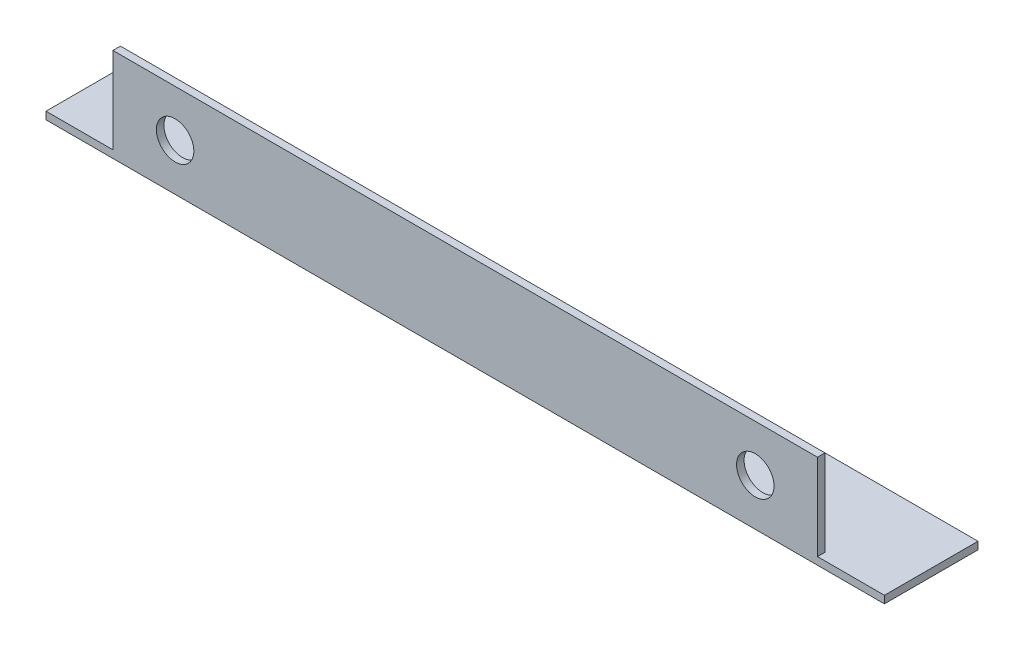
from build123d import *

# Parameters (mm, degrees)
EXTRUDE_1_DEPTH     = 224
SKETCH_2_R          = 5
SKETCH_2_W          = 17.883397414
SKETCH_2_H          = 23
CUT_EXTRUDE_1_DEPTH = 227.773014268


with BuildPart() as part:
    # Эскиз1 → Вытянуть-Тонкостенный1 (new body)
    with BuildSketch(Plane(origin=(0, 0, 0), x_dir=(0, 0, -1), z_dir=(1, 0, 0))):
        Polygon((0, 25), (0, 0), (25, 0), (25, 2), (2, 2), (2, 25), align=None)
    extrude(amount=EXTRUDE_1_DEPTH)

    # Эскиз2 → Вырез-Вытянуть1 (cut, through all)
    with BuildSketch(Plane.XY):
        with Locations((34.5, 12.5)):
            Circle(SKETCH_2_R)
        with Locations((189.5, 12.5)):
            Circle(SKETCH_2_R)
        with Locations((215.058301293, 13.5)):
            Rectangle(SKETCH_2_W, SKETCH_2_H)
        with Locations((8.941698707, 13.5)):
            Rectangle(SKETCH_2_W, SKETCH_2_H)
    extrude(amount=-CUT_EXTRUDE_1_DEPTH, mode=Mode.SUBTRACT)


solid = part.part
